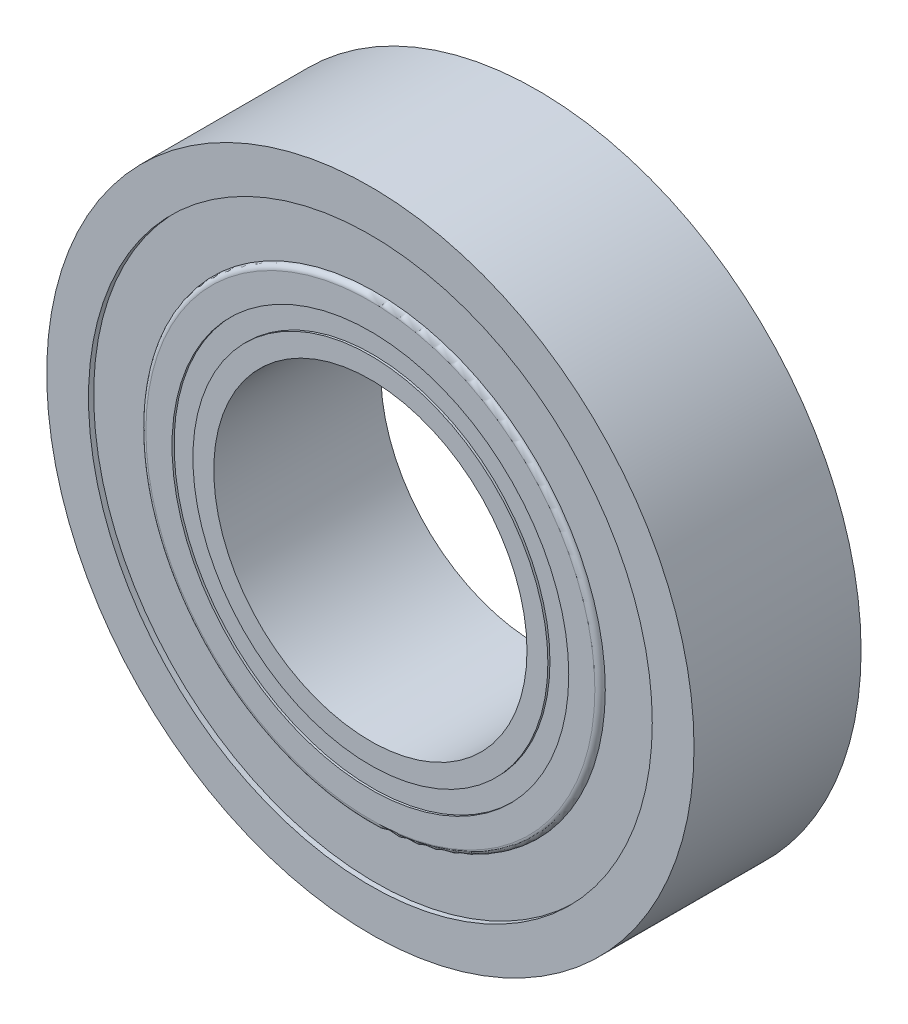
from build123d import *

# Parameters (mm, degrees)
SKETCH_1_R          = 31
SKETCH_1_R_2        = 15
EXTRUDE_1_DEPTH     = 16
SKETCH_2_R          = 27
SKETCH_2_R_2        = 22
CUT_EXTRUDE_1_DEPTH = 0.5
CUT_EXTRUDE_START   = -0.5
SKETCH_3_R          = 27
SKETCH_3_R_2        = 22
CUT_EXTRUDE_2_DEPTH = 0.5
SKETCH_4_R          = 19
SKETCH_4_R_2        = 17
CUT_EXTRUDE_3_DEPTH = 0.2
FILLET_1_R          = 0.5
CUT_EXTRUDE_START_2 = -0.2
SKETCH_5_R          = 19
SKETCH_5_R_2        = 17
CUT_EXTRUDE_4_DEPTH = 0.2


with BuildPart() as part:
    # 草图1 → 凸台-拉伸1 (new body)
    with BuildSketch(Plane.XY):
        Circle(SKETCH_1_R)
        Circle(SKETCH_1_R_2, mode=Mode.SUBTRACT)
    extrude(amount=EXTRUDE_1_DEPTH)

    # 草图2 → 切除-拉伸1 (cut)
    with BuildSketch(Plane.XY.offset(16)):
        Circle(SKETCH_2_R)
        Circle(SKETCH_2_R_2, mode=Mode.SUBTRACT)
    extrude(amount=-CUT_EXTRUDE_1_DEPTH, mode=Mode.SUBTRACT)

    # 草图3 → 切除-拉伸2 (cut)
    with BuildSketch(Plane(origin=(0, 0, 0), x_dir=(-1, 0, 0), z_dir=(0, 0, -1)).offset(CUT_EXTRUDE_START)):
        with Locations(Location((0, 0, 0), (0, 0, 180))):
            Circle(SKETCH_3_R)
        with Locations(Location((0, 0, 0), (0, 0, 180))):
            Circle(SKETCH_3_R_2, mode=Mode.SUBTRACT)
    extrude(amount=CUT_EXTRUDE_2_DEPTH, mode=Mode.SUBTRACT)

    # 草图4 → 切除-拉伸3 (cut)
    with BuildSketch(Plane.XY.offset(16)):
        Circle(SKETCH_4_R)
        Circle(SKETCH_4_R_2, mode=Mode.SUBTRACT)
    extrude(amount=-CUT_EXTRUDE_3_DEPTH, mode=Mode.SUBTRACT)

    # 圆角1
    fillet_1_edges = [part.edges().sort_by_distance(p)[0] for p in [
        (-22, 0, 16),
        (-22, 0, 0),
    ]]
    fillet(fillet_1_edges, radius=FILLET_1_R - 0.0001)  # a hair under: the kernel refuses the full size

    # 草图5 → 切除-拉伸4 (cut)
    with BuildSketch(Plane(origin=(0, 0, 0), x_dir=(-1, 0, 0), z_dir=(0, 0, -1)).offset(CUT_EXTRUDE_START_2)):
        with Locations(Location((0, 0, 0), (0, 0, 180))):
            Circle(SKETCH_5_R)
        with Locations(Location((0, 0, 0), (0, 0, 180))):
            Circle(SKETCH_5_R_2, mode=Mode.SUBTRACT)
    extrude(amount=CUT_EXTRUDE_4_DEPTH, mode=Mode.SUBTRACT)


solid = part.part
